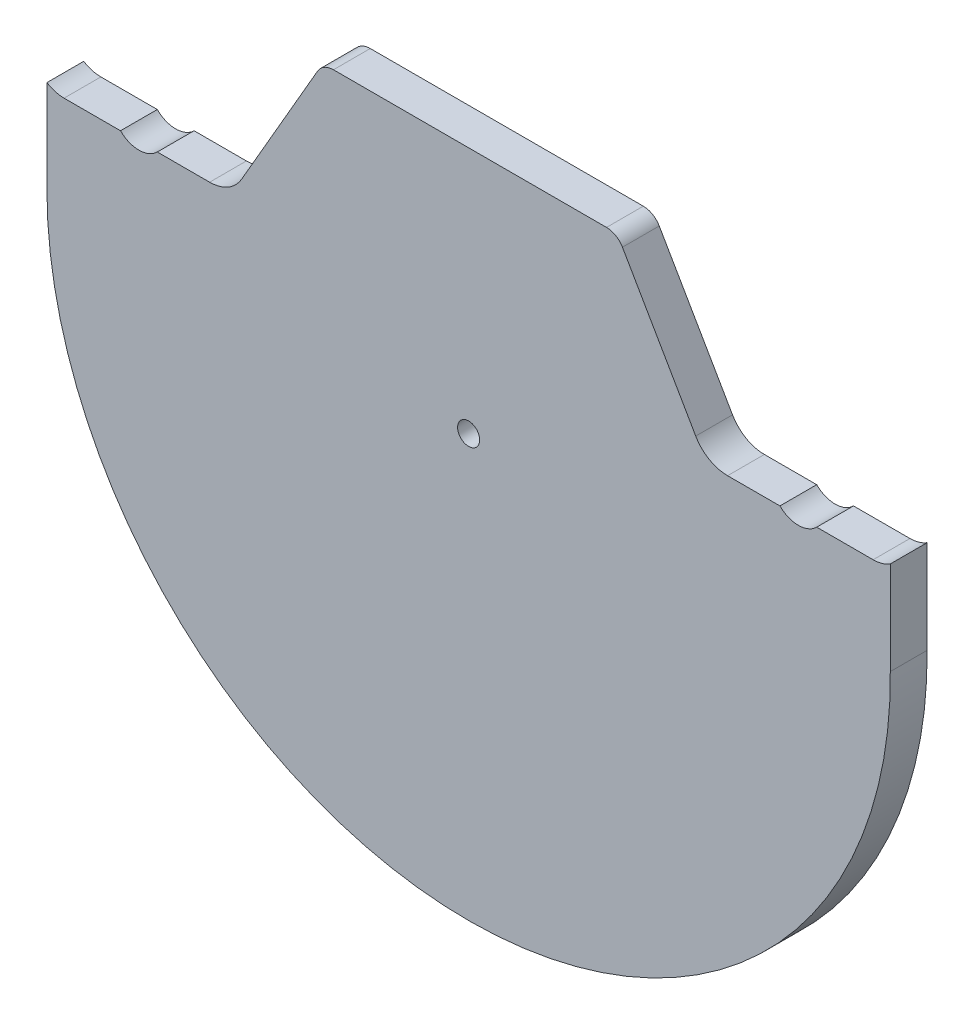
from build123d import *

# Parameters (mm, degrees)
SKIZZE2_R                       = 1.5
AUFSATZ_LINEAR_AUSTRAGEN1_DEPTH = 5


with BuildPart() as part:
    # Skizze2 → Aufsatz-Linear austragen1 (new body)
    with BuildSketch(Plane.XY):
        with BuildLine():
            Line((1.443375673, 0), (38.556624327, 0))
            ThreePointArc((38.556624327, 0), (39.806624327, -0.334936491), (40.721687836, -1.25))
            Line((40.721687836, -1.25), (50.680145631, -18.498554865))
            ThreePointArc((50.680145631, -18.498554865), (52.51027265, -20.328681884), (55.01027265, -20.998554865))
            Line((55.01027265, -20.998554865), (62.123521304, -20.998554865))
            ThreePointArc((62.123521304, -20.998554865), (64.623521304, -22.034088771), (67.123521304, -20.998554865))
            Line((67.123521304, -20.998554865), (74.793302349, -20.998554865))
            ThreePointArc((74.793302349, -20.998554865), (76.005598743, -20.827762698), (77.123521304, -20.328681884))
            Line((77.123521304, -20.328681884), (77.123521304, -32.998554865))
            ThreePointArc((77.123521304, -32.998554865), (20.139660848, -90.963323142), (-37.5, -33.650635095))
            Line((-37.5, -33.650635095), (-37.501029815, -20.980635095))
            ThreePointArc((-37.501029815, -20.980635095), (-36.382703591, -21.479811555), (-35.17, -21.650635095))
            Line((-35.17, -21.650635095), (-27.5, -21.650635095))
            ThreePointArc((-27.5, -21.650635095), (-25, -22.686169001), (-22.5, -21.650635095))
            Line((-22.5, -21.650635095), (-15.386751346, -21.650635095))
            ThreePointArc((-15.386751346, -21.650635095), (-12.886751346, -20.980762114), (-11.056624327, -19.150635095))
            Line((-11.056624327, -19.150635095), (-0.721687836, -1.25))
            ThreePointArc((-0.721687836, -1.25), (0.193375673, -0.334936491), (1.443375673, 0))
        make_face()
        with Locations((19.813615457, -33.650635095)):
            Circle(SKIZZE2_R, mode=Mode.SUBTRACT)
    extrude(amount=AUFSATZ_LINEAR_AUSTRAGEN1_DEPTH)


solid = part.part
